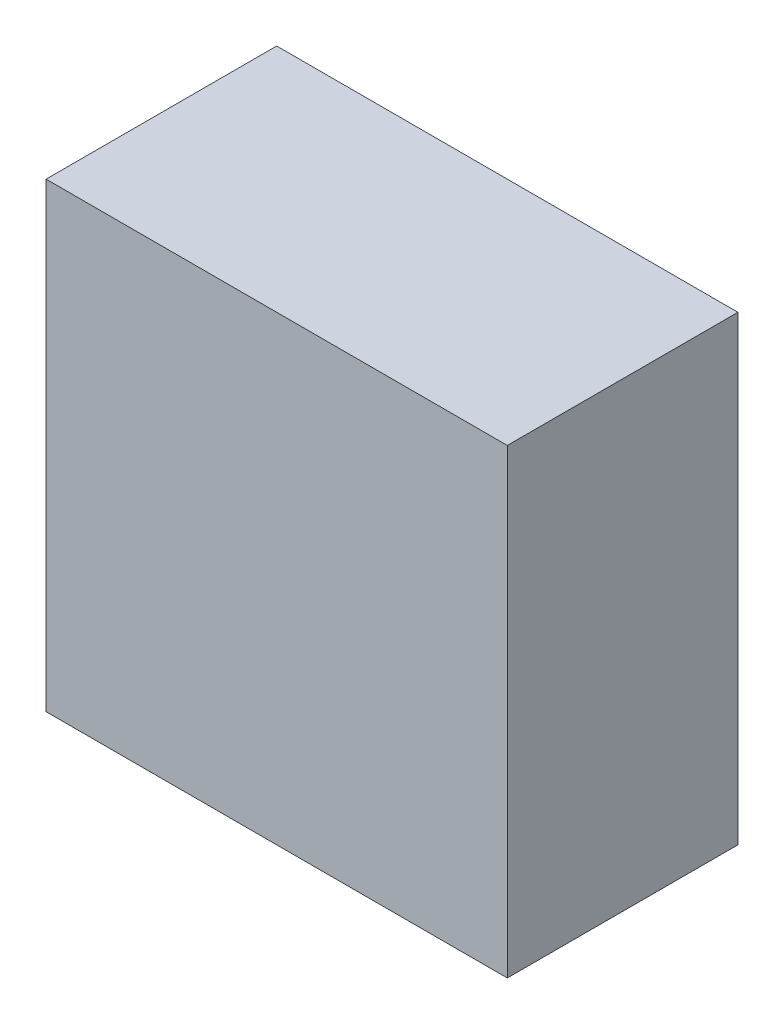
from build123d import *

# Parameters (mm, degrees)
SKETCH_1_W                  = 20
SKETCH_1_H                  = 20
BASEBOX_DEPTH               = 10
FROMOFFSETREVERSEBOSS_START = -5
SKETCH_2_R                  = 2
FROMOFFSETREVERSEBOSS_DEPTH = 5


with BuildPart() as part:
    # 草图1 → BaseBox (new body)
    with BuildSketch(Plane.XY):
        with Locations((10, 10)):
            Rectangle(SKETCH_1_W, SKETCH_1_H)
    extrude(amount=BASEBOX_DEPTH)

    # 草图2 → FromOffsetReverseBoss (add)
    with BuildSketch(Plane.XY.offset(10).offset(FROMOFFSETREVERSEBOSS_START)):
        with Locations((10, 10)):
            Circle(SKETCH_2_R)
    extrude(amount=FROMOFFSETREVERSEBOSS_DEPTH)


solid = part.part
